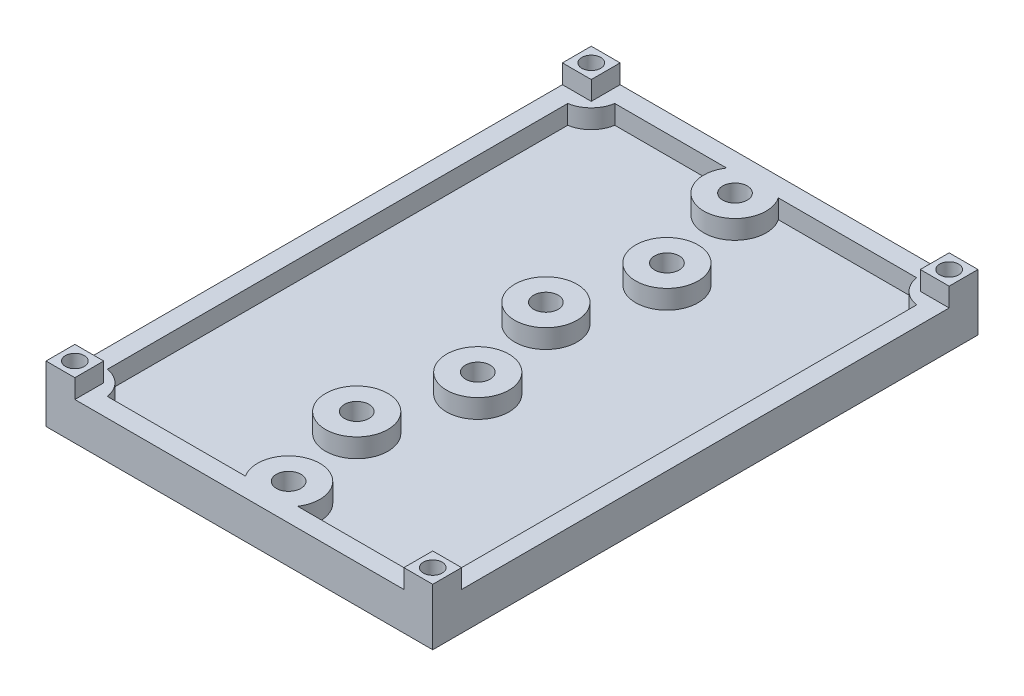
from build123d import *

# Parameters (mm, degrees)
SKETCH1_W           = 102.235
SKETCH1_H           = 144.145
SKETCH1_R           = 1.65
BOSS_EXTRUDE1_DEPTH = 10
SKETCH2_R           = 3.25
CUT_EXTRUDE1_DEPTH  = 6
SKETCH4_R           = 2.5
CUT_EXTRUDE2_DEPTH  = 178.002192783
BOSS_EXTRUDE2_START = 5
SKETCH5_W           = 7.63
SKETCH5_H           = 7.63
SKETCH5_R           = 2.5
BOSS_EXTRUDE2_DEPTH = 5
SHELL4_START        = 5
SHELL4_OUTLINE_R    = 8.25
SHELL4_DEPTH        = 5


# Read off the part's stored shape, not the designer's step: Shell4
with BuildPart() as part:
    # Sketch1 → Boss-Extrude1 (new body)
    with BuildSketch(Plane(origin=(0, 0, 0), x_dir=(1, 0, 0), z_dir=(0, 1, 0))):
        with Locations((51.1175, 72.0725)):
            Rectangle(SKETCH1_W, SKETCH1_H)
        with Locations(Location((47.6175, 134.525, 0), (0, 0, 270))):
            Circle(SKETCH1_R, mode=Mode.SUBTRACT)
        with Locations(Location((54.6175, 109.525, 0), (0, 0, 270))):
            Circle(SKETCH1_R, mode=Mode.SUBTRACT)
        with Locations(Location((54.6175, 59.525, 0), (0, 0, 270))):
            Circle(SKETCH1_R, mode=Mode.SUBTRACT)
        with Locations(Location((47.6175, 84.525, 0), (0, 0, 270))):
            Circle(SKETCH1_R, mode=Mode.SUBTRACT)
        with Locations(Location((54.6175, 9.525, 0), (0, 0, 270))):
            Circle(SKETCH1_R, mode=Mode.SUBTRACT)
        with Locations(Location((47.6175, 34.525, 0), (0, 0, 270))):
            Circle(SKETCH1_R, mode=Mode.SUBTRACT)
    extrude(amount=BOSS_EXTRUDE1_DEPTH)

    # Sketch2 → Cut-Extrude1 (cut)
    with BuildSketch(Plane(origin=(0, 10, 0), x_dir=(1, 0, 0), z_dir=(0, 1, 0))):
        with Locations(Location((47.6175, 134.525, 0), (0, 0, 270))):
            Circle(SKETCH2_R)
        with Locations(Location((54.6175, 109.525, 0), (0, 0, 270))):
            Circle(SKETCH2_R)
        with Locations(Location((47.6175, 84.525, 0), (0, 0, 270))):
            Circle(SKETCH2_R)
        with Locations(Location((54.6175, 59.525, 0), (0, 0, 270))):
            Circle(SKETCH2_R)
        with Locations(Location((47.6175, 34.525, 0), (0, 0, 270))):
            Circle(SKETCH2_R)
        with Locations(Location((54.6175, 9.525, 0), (0, 0, 270))):
            Circle(SKETCH2_R)
    extrude(amount=-CUT_EXTRUDE1_DEPTH, mode=Mode.SUBTRACT)

    # Sketch4 → Cut-Extrude2 (cut, through all)
    with BuildSketch(Plane(origin=(0, 10, 0), x_dir=(1, 0, 0), z_dir=(0, 1, 0))):
        with Locations(Location((3.815, 140.33, 0), (0, 0, 270))):
            Circle(SKETCH4_R)
        with Locations(Location((98.42, 140.33, 0), (0, 0, 90))):
            Circle(SKETCH4_R)
        with Locations(Location((98.42, 3.815, 0), (0, 0, 270))):
            Circle(SKETCH4_R)
        with Locations(Location((3.815, 3.815, 0), (0, 0, 90))):
            Circle(SKETCH4_R)
    extrude(amount=-CUT_EXTRUDE2_DEPTH, mode=Mode.SUBTRACT)

    # Sketch5 → Boss-Extrude2 (add)
    # profile 1 of 4: a face of its own
    with BuildSketch(Plane(origin=(0, 10, 0), x_dir=(1, 0, 0), z_dir=(0, 1, 0)).offset(BOSS_EXTRUDE2_START)):
        with Locations((3.815, 140.33)):
            Rectangle(SKETCH5_W, SKETCH5_H)
        with Locations(Location((3.815, 140.33, 0), (0, 0, 270))):
            Circle(SKETCH5_R, mode=Mode.SUBTRACT)
    # profile 2 of 4: a face of its own
    with BuildSketch(Plane(origin=(0, 10, 0), x_dir=(1, 0, 0), z_dir=(0, 1, 0)).offset(BOSS_EXTRUDE2_START)):
        with Locations((98.42, 140.33)):
            Rectangle(SKETCH5_W, SKETCH5_H)
        with Locations(Location((98.42, 140.33, 0), (0, 0, 90))):
            Circle(SKETCH5_R, mode=Mode.SUBTRACT)
    # profile 3 of 4: a face of its own
    with BuildSketch(Plane(origin=(0, 10, 0), x_dir=(1, 0, 0), z_dir=(0, 1, 0)).offset(BOSS_EXTRUDE2_START)):
        with Locations((98.42, 3.815)):
            Rectangle(SKETCH5_W, SKETCH5_H)
        with Locations(Location((98.42, 3.815, 0), (0, 0, 270))):
            Circle(SKETCH5_R, mode=Mode.SUBTRACT)
    # profile 4 of 4: a face of its own
    with BuildSketch(Plane(origin=(0, 10, 0), x_dir=(1, 0, 0), z_dir=(0, 1, 0)).offset(BOSS_EXTRUDE2_START)):
        with Locations((3.815, 3.815)):
            Rectangle(SKETCH5_W, SKETCH5_H)
        with Locations(Location((3.815, 3.815, 0), (0, 0, 90))):
            Circle(SKETCH5_R, mode=Mode.SUBTRACT)
    extrude(amount=-BOSS_EXTRUDE2_DEPTH)

    # Shell4 outline → Shell4 (cut)
    with BuildSketch(Plane(origin=(0, 0, 0), x_dir=(1, 0, 0), z_dir=(0, 1, 0)).offset(SHELL4_START)):
        with BuildLine():
            ThreePointArc((47.719175928, 5), (54.6175, 17.775), (61.515824072, 5))
            Line((61.515824072, 5), (91.01420666, 5))
            ThreePointArc((91.01420666, 5), (93.116699141, 9.118300859), (97.235, 11.22079334))
            Line((97.235, 11.22079334), (97.235, 132.92420666))
            ThreePointArc((97.235, 132.92420666), (93.116699141, 135.026699141), (91.01420666, 139.145))
            Line((91.01420666, 139.145), (54.452564008, 139.145))
            ThreePointArc((54.452564008, 139.145), (47.6175, 126.275), (40.782435992, 139.145))
            Line((40.782435992, 139.145), (11.22079334, 139.145))
            ThreePointArc((11.22079334, 139.145), (9.118300859, 135.026699141), (5, 132.92420666))
            Line((5, 132.92420666), (5, 11.22079334))
            ThreePointArc((5, 11.22079334), (9.118300859, 9.118300859), (11.22079334, 5))
            Line((11.22079334, 5), (47.719175928, 5))
        make_face()
        with Locations((47.6175, 34.525)):
            Circle(SHELL4_OUTLINE_R, mode=Mode.SUBTRACT)
        with Locations((54.6175, 59.525)):
            Circle(SHELL4_OUTLINE_R, mode=Mode.SUBTRACT)
        with Locations((47.6175, 84.525)):
            Circle(SHELL4_OUTLINE_R, mode=Mode.SUBTRACT)
        with Locations((54.6175, 109.525)):
            Circle(SHELL4_OUTLINE_R, mode=Mode.SUBTRACT)
    extrude(amount=SHELL4_DEPTH, mode=Mode.SUBTRACT)


solid = part.part
